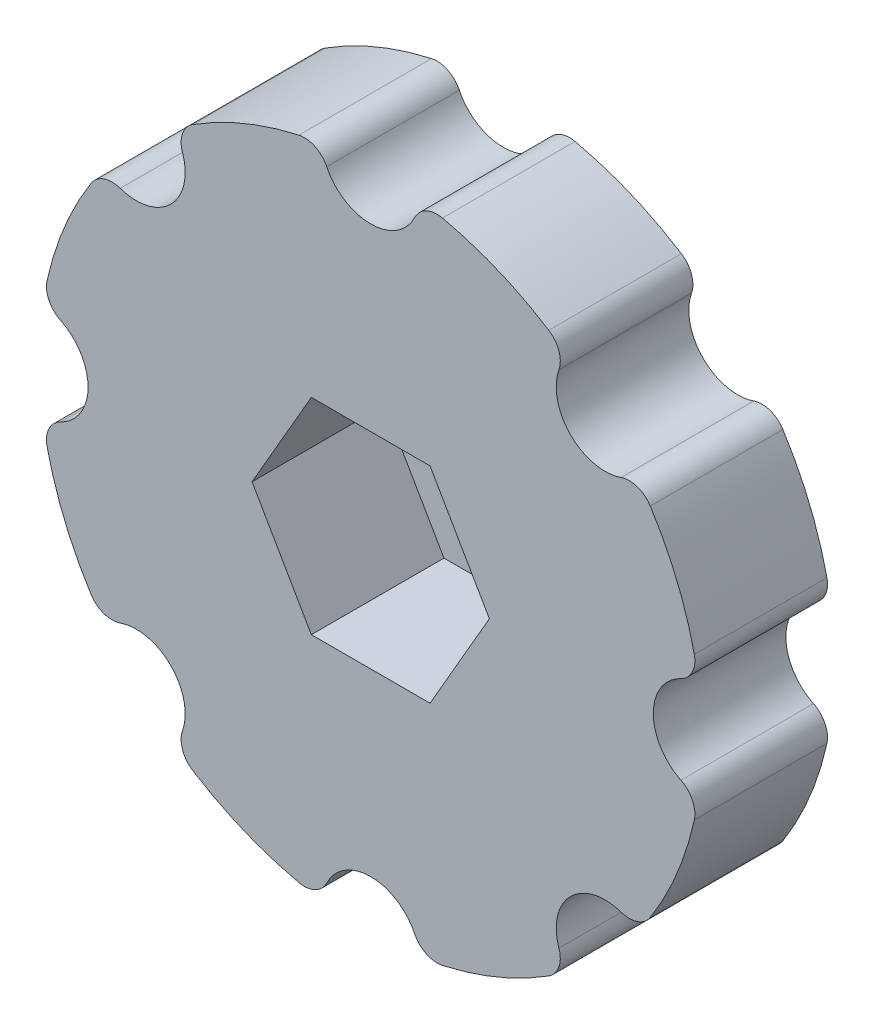
from build123d import *

# Parameters (mm, degrees)
CROQUIS1_R              = 20
SALIENTE_EXTRUIR1_DEPTH = 8
CORTAR_EXTRUIR1_DEPTH   = 8
CORTAR_EXTRUIR2_DEPTH   = 10
CROQUIS4_R              = 10
CROQUIS4_R_2            = 2.15
SALIENTE_EXTRUIR2_DEPTH = 3
REDONDEO1_R             = 10
REDONDEO2_R             = 10
CROQUIS5_R              = 2.95
CORTAR_EXTRUIR4_DEPTH   = 31.099222036
REDONDEO4_R             = 1.5


with BuildPart() as part:
    # Croquis1 → Saliente-Extruir1 (new body)
    with BuildSketch(Plane.XY):
        Circle(CROQUIS1_R)
        with BuildLine():
            Line((-1.204159458, 1.2), (1.204159458, 1.2))
            ThreePointArc((1.204159458, 1.2), (0, -1.7), (-1.204159458, 1.2))
        make_face(mode=Mode.SUBTRACT)
    extrude(amount=-SALIENTE_EXTRUIR1_DEPTH)

    # Croquis2 → Cortar-Extruir1 (cut)
    with BuildSketch(Plane.XY):
        with BuildLine():
            ThreePointArc((2.743493279, 19.8109375), (0, 20), (-2.743493279, 19.8109375))
            ThreePointArc((-2.743493279, 19.8109375), (0, 17.25), (2.743493279, 19.8109375))
        make_face()
        with BuildLine():
            ThreePointArc((-15.948597043, 12.068233192), (-12.197270604, 12.196913347), (-12.068700327, 15.948243553))
            ThreePointArc((-12.068700327, 15.948243553), (-14.142342736, 14.141928508), (-15.948597043, 12.068233192))
        make_face()
        with BuildLine():
            ThreePointArc((15.948184756, 12.068778024), (14.141928523, 14.142342722), (12.068310924, 15.948538223))
            ThreePointArc((12.068310924, 15.948538223), (12.197913345, 12.198270606), (15.948184756, 12.068778024))
        make_face()
        with BuildLine():
            ThreePointArc((-19.810790862, -2.744551953), (-17.249000003, -0.000862493), (-19.811065232, 2.742570761))
            ThreePointArc((-19.811065232, 2.742570761), (-19.999999975, -0.00100005), (-19.810790862, -2.744551953))
        make_face()
        with BuildLine():
            ThreePointArc((19.811084118, -2.742434336), (19.999999975, 0.00099995), (19.810809789, 2.744415332))
            ThreePointArc((19.810809789, 2.744415332), (17.251000003, 0.000862507), (19.811084118, -2.742434336))
        make_face()
        with BuildLine():
            ThreePointArc((-12.06710539, -15.949450383), (-12.196050859, -12.198133106), (-15.947390094, -12.069828051))
            ThreePointArc((-15.947390094, -12.069828051), (-14.140928423, -14.143342722), (-12.06710539, -15.949450383))
        make_face()
        with BuildLine():
            ThreePointArc((12.069905665, -15.947331352), (14.143342636, -14.140928508), (15.949391508, -12.067183206))
            ThreePointArc((15.949391508, -12.067183206), (12.199133118, -12.197050847), (12.069905665, -15.947331352))
        make_face()
        with BuildLine():
            ThreePointArc((2.745474352, -19.810663053), (0.001725, -17.250000014), (-2.741512165, -19.811211751))
            ThreePointArc((-2.741512165, -19.811211751), (0.002, -19.9999999), (2.745474352, -19.810663053))
        make_face()
    extrude(amount=-CORTAR_EXTRUIR1_DEPTH, mode=Mode.SUBTRACT)

    # Croquis3 → Cortar-Extruir2 (cut)
    with BuildSketch(Plane(origin=(0, 0, -8), x_dir=(-1, 0, 0), z_dir=(0, 0, -1))):
        Polygon((7.159143338, 0), (3.579571669, 6.2), (-3.579571669, 6.2), (-7.159143338, 0), (-3.579571669, -6.2), (3.579571669, -6.2), align=None)
    extrude(amount=-CORTAR_EXTRUIR2_DEPTH, mode=Mode.SUBTRACT)

    # Croquis4 → Saliente-Extruir2 (add)
    with BuildSketch(Plane(origin=(0, 0, -8), x_dir=(-1, 0, 0), z_dir=(0, 0, -1))):
        with Locations(Location((0, 0, 0), (0, 0, 180))):
            Circle(CROQUIS4_R)
        Circle(CROQUIS4_R_2, mode=Mode.SUBTRACT)
    extrude(amount=SALIENTE_EXTRUIR2_DEPTH)

    # Redondeo1
    # the kernel refuses this fillet: 10 mm, written as the material it adds along each edge
    with BuildSketch(Plane(origin=(0, 0, -8), x_dir=(1, 0, 0), z_dir=(0, 1, 0))) as redondeo1_piece_1:
        with BuildLine():
            CenterArc((17.141428429, 10), REDONDEO1_R, 224.427004001, 45.572995999)
            Line((10, 3), (9.857171431, 2.86))
            ThreePointArc((9.857171431, 2.86), (9.8, 1.5), (9.8, 0))
            Line((9.8, 0), (10, -0.2))
            Line((10, -0.2), (17.141428429, -0.2))
            Line((17.141428429, -0.2), (17.141428429, 0))
        make_face()
    revolve(axis=Axis((0, 0, -8), (0, 0, -1)))

    # Redondeo2
    redondeo2_edges = [part.edges().sort_by_distance(p)[0] for p in [
        (-10, 0, -11),
    ]]
    fillet(redondeo2_edges, radius=REDONDEO2_R)

    # Croquis5 → Cortar-Extruir4 (cut, through all)
    with BuildSketch(Plane.XY):
        with Locations((0, 20)):
            Circle(CROQUIS5_R)
        with Locations((14.142135624, 14.142135624)):
            Circle(CROQUIS5_R)
        with Locations((20, 0)):
            Circle(CROQUIS5_R)
        with Locations((14.142135624, -14.142135624)):
            Circle(CROQUIS5_R)
        with Locations((0, -20)):
            Circle(CROQUIS5_R)
        with Locations((-14.142135624, -14.142135624)):
            Circle(CROQUIS5_R)
        with Locations((-20, 0)):
            Circle(CROQUIS5_R)
        with Locations((-14.142135624, 14.142135624)):
            Circle(CROQUIS5_R)
    extrude(amount=-CORTAR_EXTRUIR4_DEPTH, mode=Mode.SUBTRACT)

    # Redondeo4
    redondeo4_edges = [part.edges().sort_by_distance(p)[0] for p in [
        (-11.908011282, 16.068580127, -4),
        (-16.068580127, 11.908011282, -4),
        (-19.7824375, -2.941966444, -4),
        (-19.7824375, 2.941966444, -4),
        (-16.068580127, -11.908011282, -4),
        (-11.908011282, -16.068580127, -4),
        (2.941966444, -19.7824375, -4),
        (-2.941966444, -19.7824375, -4),
        (11.908011282, -16.068580127, -4),
        (16.068580127, -11.908011282, -4),
        (19.7824375, 2.941966444, -4),
        (19.7824375, -2.941966444, -4),
        (11.908011282, 16.068580127, -4),
        (16.068580127, 11.908011282, -4),
        (-2.941966444, 19.7824375, -4),
        (2.941966444, 19.7824375, -4),
    ]]
    fillet(redondeo4_edges, radius=REDONDEO4_R)


solid = part.part
